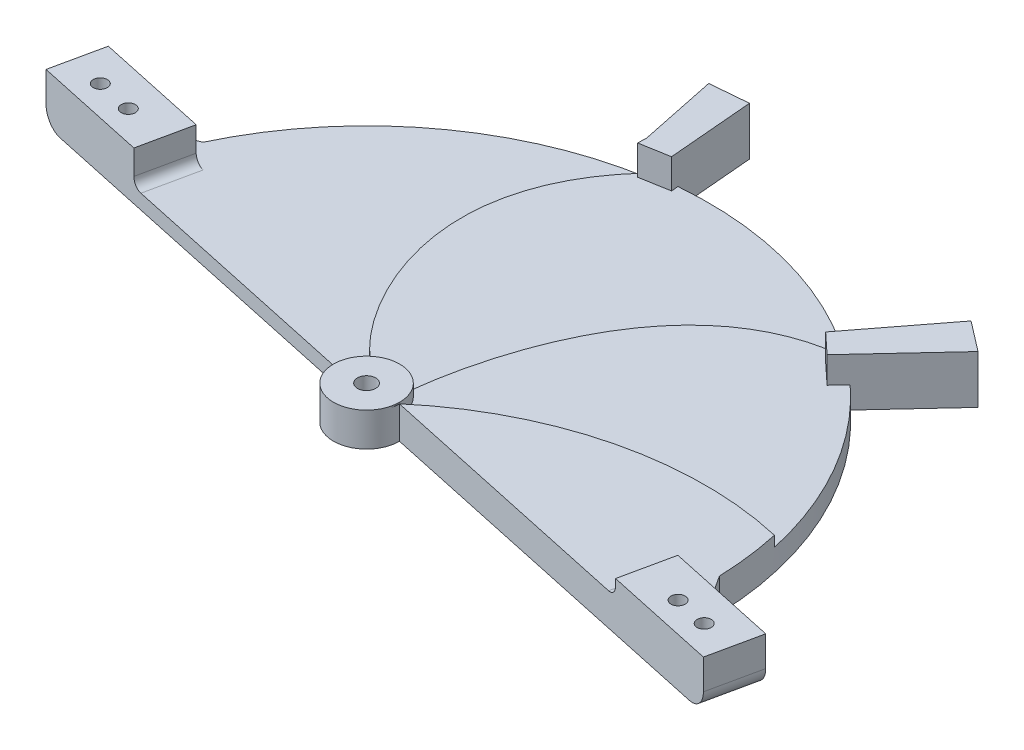
from build123d import *
from build123d.topology import SkipClean

# Parameters (mm, degrees)
SKETCH1_R            = 7.25
SKETCH1_R_2          = 2
BOSS_EXTRUDE1_DEPTH  = 7.4
BOSS_EXTRUDE3_START  = -7.4
BOSS_EXTRUDE3_DEPTH  = 2.5
BOSS_EXTRUDE4_DEPTH  = 0.9
BOSS_EXTRUDE5_DEPTH  = 0.7
BOSS_EXTRUDE6_DEPTH  = 8.4
BOSS_EXTRUDE7_START  = -2.5
BOSS_EXTRUDE7_DEPTH  = 8.4
BOSS_EXTRUDE8_START  = -4.1
BOSS_EXTRUDE8_DEPTH  = 8.4
CUT_EXTRUDE1_DEPTH   = 5
BOSS_EXTRUDE9_START  = 5
SKETCH10_R           = 7.25
SKETCH10_R_2         = 2
BOSS_EXTRUDE9_DEPTH  = 5
BOSS_EXTRUDE10_REACH = 122.721
CUT_EXTRUDE2_DEPTH   = 121.788738675
CUT_EXTRUDE3_START   = -1.3
CUT_EXTRUDE3_DEPTH   = 1.3
SKETCH17_R           = 1.55
CUT_EXTRUDE4_DEPTH   = 121.936633783
SKETCH18_R           = 1.55
BOSS_EXTRUDE11_DEPTH = 1.2
SKETCH19_R           = 1.55
BOSS_EXTRUDE12_DEPTH = 2.5
CUT_EXTRUDE5_DEPTH   = 122.0259038
SKETCH21_R           = 1.55
BOSS_EXTRUDE13_DEPTH = 1
BOSS_EXTRUDE14_DEPTH = 0.7
BOSS_EXTRUDE16_DEPTH = 0.7
BOSS_EXTRUDE17_DEPTH = 1.4
FILLET1_R            = 2
FILLET2_R            = 4
CHAMFER1_SIZE        = 4
CHAMFER1_SIZE_2      = 4.928784719
BOSS_EXTRUDE18_DEPTH = 10.6


with BuildPart() as part:
    # Sketch1 → Boss-Extrude1 (new body)
    with BuildSketch(Plane(origin=(0, 0, 0), x_dir=(1, 0, 0), z_dir=(0, 1, 0))):
        with Locations(Location((0, 0, 0), (0, 0, 270))):
            Circle(SKETCH1_R)
        with Locations(Location((0, 0, 0), (0, 0, 270))):
            Circle(SKETCH1_R_2, mode=Mode.SUBTRACT)
    extrude(amount=BOSS_EXTRUDE1_DEPTH)

    # Sketch2 → Boss-Extrude3 (add)
    with BuildSketch(Plane(origin=(0, 7.4, 0), x_dir=(1, 0, 0), z_dir=(0, 1, 0)).offset(BOSS_EXTRUDE3_START)):
        with BuildLine():
            add(Edge.make_bspline(
                [(-5.126524164, -5.126524164), (-34.917072205, -19.205568344), (-61.161686636, -4.675863942), (-71.850724271, 21.505195227)],
                knots=[0, 0, 0, 0, 0.672240243, 0.672240243, 0.672240243, 0.672240243], degree=3))
            ThreePointArc((-5.126524164, -5.126524164), (-2.774454885, 6.698126611), (7.25, 0))
            Line((7.25, 0), (75, 0))
            ThreePointArc((75, 0), (38.729833462, 64.226162893), (-35, 66.332495807))
            ThreePointArc((-35, 66.332495807), (-57.936525945, 47.62729219), (-71.850724271, 21.505195227))
        make_face()
    extrude(amount=BOSS_EXTRUDE3_DEPTH)

    # Sketch3 → Boss-Extrude4 (add)
    with BuildSketch(Plane(origin=(0, 2.5, 0), x_dir=(1, 0, 0), z_dir=(0, 1, 0))):
        with BuildLine():
            add(Edge.make_bspline(
                [(-3.625, 6.278684177), (-10.597848388, 6.793882103), (-40.677167551, 43.511602441), (-12.374173258, 73.972155817)],
                knots=[0, 0, 0, 0, 0.867348457, 0.867348457, 0.867348457, 0.867348457], degree=3))
            ThreePointArc((-3.625, 6.278684177), (3.625, 6.278684177), (7.25, 0))
            Line((7.25, 0), (75, 0))
            ThreePointArc((75, 0), (48.460999812, 57.2409949), (-12.374173258, 73.972155817))
        make_face()
    extrude(amount=BOSS_EXTRUDE4_DEPTH)



with BuildPart() as body_2:
    # Sketch4 → Boss-Extrude5 (new body)
    with BuildSketch(Plane(origin=(0, 3.4, 0), x_dir=(1, 0, 0), z_dir=(0, 1, 0))):
        with BuildLine():
            Line((7.25, 0), (75, 0))
            ThreePointArc((75, 0), (67.082039325, 33.541019662), (45, 60))
            add(Edge.make_bspline(
                [(3.625, 6.278684177), (4.262653192, 12.246368212), (10.323317408, 56.764848912), (45, 60)],
                knots=[0, 0, 0, 0, 1, 1, 1, 1], degree=3))
            ThreePointArc((3.625, 6.278684177), (6.278684177, 3.625), (7.25, 0))
        make_face()
    extrude(amount=BOSS_EXTRUDE5_DEPTH)


with BuildPart() as part_1:
    with SkipClean():  # the faces are left unmerged after this step: merging them gives an invalid solid
        add(part.part)

        add(body_2.part)  # Boss-Extrude6 merges body 2
        # Sketch6 → Boss-Extrude6 (add)
        with BuildSketch(Plane(origin=(0, 0, 0), x_dir=(-1, 0, 0), z_dir=(0, -1, 0))):
            with BuildLine():
                ThreePointArc((-75, 0), (-74.579396143, -7.931813846), (-73.32230211, -15.774663651))
                Line((-73.32230211, -15.774663651), (-7.087822537, -1.524884153))
                ThreePointArc((-7.087822537, -1.524884153), (-7.209341627, -0.766742005), (-7.25, 0))
                Line((-7.25, 0), (-75, 0))
            make_face()
        extrude(amount=-BOSS_EXTRUDE6_DEPTH)

    # Sketch7 → Boss-Extrude7 (add)
    with BuildSketch(Plane(origin=(0, 2.5, 0), x_dir=(1, 0, 0), z_dir=(0, 1, 0)).offset(BOSS_EXTRUDE7_START)):
        with BuildLine():
            Line((-63.545995162, 13.671375165), (-81.876570689, 17.615041077))
            Line((-81.876570689, 17.615041077), (-79.142687321, 30.32241961))
            Line((-79.142687321, 30.32241961), (-59.52859355, 26.102615769))
            ThreePointArc((-59.52859355, 26.102615769), (-61.850404464, 19.9881832), (-63.545995162, 13.671375165))
        make_face()
    extrude(amount=BOSS_EXTRUDE7_DEPTH)

    # Sketch8 → Boss-Extrude8 (add)
    with SkipClean():  # the faces are left unmerged after this step: merging them gives an invalid solid
        with BuildSketch(Plane(origin=(0, 4.1, 0), x_dir=(1, 0, 0), z_dir=(0, 1, 0)).offset(BOSS_EXTRUDE8_START)):
            Polygon((-79.142687321, 30.32241961), (-81.876570689, 17.615041077), (-91.765372585, 19.742531886), (-89.031489217, 32.449910419), align=None)
            with BuildLine():
                Line((73.32230211, -15.774663651), (91.765372585, -19.742531886))
                Line((91.765372585, -19.742531886), (94.499255953, -7.035153354))
                Line((94.499255953, -7.035153354), (74.946642057, -2.82857638))
                ThreePointArc((74.946642057, -2.82857638), (74.416532068, -9.33700996), (73.32230211, -15.774663651))
            make_face()
        extrude(amount=BOSS_EXTRUDE8_DEPTH)

    # Sketch9 → Cut-Extrude1 (cut)
    with BuildSketch(Plane.XZ):
        Polygon((-91.765372585, -19.742531886), (91.765372585, 19.742531886), (87.979453309, 37.339884393), (-95.551291862, -2.14517938), align=None)
    extrude(amount=-CUT_EXTRUDE1_DEPTH, mode=Mode.SUBTRACT)

    # Sketch10 → Boss-Extrude9 (add)
    with BuildSketch(Plane.XZ.offset(-5).offset(BOSS_EXTRUDE9_START)):
        Circle(SKETCH10_R)
        with Locations(Location((0, 0, 0), (0, 0, 90))):
            Circle(SKETCH10_R_2, mode=Mode.SUBTRACT)
    extrude(amount=-BOSS_EXTRUDE9_DEPTH)

    # Boss-Extrude10: up to this face of the body (flat: up to its plane)
    boss_extrude10_end = Plane(part_1.part.faces().sort_by_distance((60.073544854, 8.4, 7.102164941))[0])
    # Sketch12 → Boss-Extrude10 (add, up to the picked face)
    with BuildSketch(Plane(origin=(0, 4.1, 0), x_dir=(1, 0, 0), z_dir=(0, 1, 0)), mode=Mode.PRIVATE) as boss_extrude10_sk1:
        with BuildLine():
            Line((7.25, 0), (75, 0))
            ThreePointArc((75, 0), (74.56036467, 8.108761945), (73.246612793, 16.122459937))
            ThreePointArc((73.246612793, 16.122459937), (38.330105093, 15.91330646), (7.25, 0))
        make_face()
    boss_extrude10_tool1 = split(extrude(boss_extrude10_sk1.sketch, amount=BOSS_EXTRUDE10_REACH, mode=Mode.PRIVATE), bisect_by=boss_extrude10_end, keep=Keep.BOTH, mode=Mode.PRIVATE)
    add(boss_extrude10_tool1.solids().sort_by(Axis((46.982662, 4.1, -7.736412), (0, 1, 0)))[0])

    # Sketch13 → Cut-Extrude2 (cut, through all)
    with SkipClean():  # the faces are left unmerged after this step: merging them gives an invalid solid
        with BuildSketch(Plane(origin=(0, 2.5, 0), x_dir=(1, 0, 0), z_dir=(0, 1, 0))):
            Polygon((-59.52859355, 26.102615769), (-61.850404464, 19.9881832), (-63.545995162, 13.671375165), (-67.237617804, 14.465596075), (-64.503734436, 27.172974607), align=None)
        extrude(amount=CUT_EXTRUDE2_DEPTH, mode=Mode.SUBTRACT)

    # Sketch16 → Cut-Extrude3 (cut)
    with SkipClean():  # the faces are left unmerged after this step: merging them gives an invalid solid
        with BuildSketch(Plane(origin=(0, 8.4, 0), x_dir=(1, 0, 0), z_dir=(0, 1, 0)).offset(CUT_EXTRUDE3_START)):
            with BuildLine():
                Line((7.087822537, -1.524884153), (7.25, 0))
                ThreePointArc((7.25, 0), (38.330105093, 15.91330646), (73.246612793, 16.122459937))
                ThreePointArc((73.246612793, 16.122459937), (74.809258318, 6.710869331), (74.946642057, -2.82857638))
                Line((74.946642057, -2.82857638), (94.499255953, -7.035153354))
                Line((94.499255953, -7.035153354), (91.765372585, -19.742531886))
                Line((91.765372585, -19.742531886), (7.087822537, -1.524884153))
            make_face()
        extrude(amount=CUT_EXTRUDE3_DEPTH, mode=Mode.SUBTRACT)

    # Sketch17 → Cut-Extrude4 (cut, through all)
    with SkipClean():  # the faces are left unmerged after this step: merging them gives an invalid solid
        with BuildSketch(Plane.XZ):
            with Locations(Location((-82.816641613, -24.466016677, 0), (0, 0, 270))):
                Circle(SKETCH17_R)
            with Locations(Location((-74.995596054, -22.783385887, 0), (0, 0, 270))):
                Circle(SKETCH17_R)
            with Locations(Location((78.500615114, 10.240005813, 0), (0, 0, 270))):
                Circle(SKETCH17_R)
            with Locations(Location((85.785548012, 11.807296568, 0), (0, 0, 270))):
                Circle(SKETCH17_R)
        extrude(amount=-CUT_EXTRUDE4_DEPTH, mode=Mode.SUBTRACT)

    # Sketch18 → Boss-Extrude11 (add)
    with SkipClean():  # the faces are left unmerged after this step: merging them gives an invalid solid
        with BuildSketch(Plane(origin=(0, 8.4, 0), x_dir=(1, 0, 0), z_dir=(0, 1, 0))):
            Polygon((-89.031489217, 32.449910419), (-64.503734436, 27.172974607), (-67.237617804, 14.465596075), (-91.765372585, 19.742531886), align=None)
            with Locations(Location((-82.816641613, 24.466016677, 0), (0, 0, 90))):
                Circle(SKETCH18_R, mode=Mode.SUBTRACT)
            with Locations(Location((-74.995596054, 22.783385887, 0), (0, 0, 90))):
                Circle(SKETCH18_R, mode=Mode.SUBTRACT)
        extrude(amount=BOSS_EXTRUDE11_DEPTH)

    # Sketch19 → Boss-Extrude12 (add)
    with SkipClean():  # the faces are left unmerged after this step: merging them gives an invalid solid
        with BuildSketch(Plane(origin=(0, 7.1, 0), x_dir=(1, 0, 0), z_dir=(0, 1, 0))):
            Polygon((91.765372585, -19.742531886), (94.499255953, -7.035153354), (69.970501821, -1.758002541), (67.236618453, -14.465381073), align=None)
            with Locations(Location((78.500615114, -10.240005813, 0), (0, 0, 90))):
                Circle(SKETCH19_R, mode=Mode.SUBTRACT)
            with Locations(Location((85.785548012, -11.807296568, 0), (0, 0, 90))):
                Circle(SKETCH19_R, mode=Mode.SUBTRACT)
        extrude(amount=BOSS_EXTRUDE12_DEPTH)

    # Sketch20 → Cut-Extrude5 (cut, through all)
    with SkipClean():  # the faces are left unmerged after this step: merging them gives an invalid solid
        with BuildSketch(Plane.XZ):
            with BuildLine():
                Line((7.249919711, 0.034120129), (92.080865858, 18.276085844))
                Line((92.080865858, 18.276085844), (91.765372585, 19.742531886))
                Line((91.765372585, 19.742531886), (7.087822537, 1.524884153))
                ThreePointArc((7.087822537, 1.524884153), (7.207517432, 0.78370432), (7.249919711, 0.034120129))
            make_face()
            with BuildLine():
                Line((-7.087822537, -1.524884153), (-91.765372585, -19.742531886))
                Line((-91.765372585, -19.742531886), (-91.449879312, -21.208977929))
                Line((-91.449879312, -21.208977929), (-6.618968806, -2.95833601))
                ThreePointArc((-6.618968806, -2.95833601), (-6.89077124, -2.25383489), (-7.087822537, -1.524884153))
            make_face()
        extrude(amount=-CUT_EXTRUDE5_DEPTH, mode=Mode.SUBTRACT)

    # Sketch21 → Boss-Extrude13 (add)
    # profile 1 of 2: a face of its own
    with SkipClean():  # the faces are left unmerged after this step: merging them gives an invalid solid
        with BuildSketch(Plane(origin=(0, 9.6, 0), x_dir=(1, 0, 0), z_dir=(0, 1, 0))):
            Polygon((69.970501821, -1.758002541), (67.551595408, -13.001334932), (92.080865858, -18.276085844), (94.499255953, -7.035153354), align=None)
            with Locations(Location((85.785548012, -11.807296568, 0), (0, 0, 90))):
                Circle(SKETCH21_R, mode=Mode.SUBTRACT)
            with Locations(Location((78.500615114, -10.240005813, 0), (0, 0, 90))):
                Circle(SKETCH21_R, mode=Mode.SUBTRACT)
        # profile 2 of 2: a face of its own
        with BuildSketch(Plane(origin=(0, 9.6, 0), x_dir=(1, 0, 0), z_dir=(0, 1, 0))):
            Polygon((-89.031489217, 32.449910419), (-91.449879312, 21.208977929), (-66.922124531, 15.932042117), (-64.503734436, 27.172974607), align=None)
            with Locations(Location((-74.995596054, 22.783385887, 0), (0, 0, 90))):
                Circle(SKETCH21_R, mode=Mode.SUBTRACT)
            with Locations(Location((-82.816641613, 24.466016677, 0), (0, 0, 90))):
                Circle(SKETCH21_R, mode=Mode.SUBTRACT)
        extrude(amount=BOSS_EXTRUDE13_DEPTH)

    # Sketch22 → Boss-Extrude14 (add)
    with SkipClean():  # the faces are left unmerged after this step: merging them gives an invalid solid
        with BuildSketch(Plane(origin=(0, 2.5, 0), x_dir=(1, 0, 0), z_dir=(0, 1, 0))):
            with BuildLine():
                Line((-66.922124531, 15.932042117), (-6.618968806, 2.95833601))
                ThreePointArc((-6.618968806, 2.95833601), (-5.384320033, 4.855058989), (-3.625, 6.278684177))
                add(Edge.make_bspline(
                    [(-3.625, 6.278684177), (-10.597848388, 6.793882103), (-40.677167551, 43.511602441), (-12.374173258, 73.972155817)],
                    knots=[0, 0, 0, 0, 0.867348457, 0.867348457, 0.867348457, 0.867348457], degree=3))
                ThreePointArc((-12.374173258, 73.972155817), (-46.880291054, 58.542619609), (-69.478875321, 28.243333445))
                Line((-69.478875321, 28.243333445), (-64.503734436, 27.172974607))
                Line((-64.503734436, 27.172974607), (-66.922124531, 15.932042117))
            make_face()
        extrude(amount=BOSS_EXTRUDE14_DEPTH)

    # Sketch23 → Boss-Extrude16 (add)
    with SkipClean():  # the faces are left unmerged after this step: merging them gives an invalid solid
        with BuildSketch(Plane(origin=(0, 3.4, 0), x_dir=(1, 0, 0), z_dir=(0, 1, 0))):
            with BuildLine():
                ThreePointArc((45, 60), (17.745884796, 72.870320246), (-12.374173258, 73.972155817))
                add(Edge.make_bspline(
                    [(-12.374173258, 73.972155817), (-40.677167551, 43.511602441), (-10.597848388, 6.793882103), (-3.625, 6.278684177)],
                    knots=[0, 0, 0, 0, 0.867348457, 0.867348457, 0.867348457, 0.867348457], degree=3))
                ThreePointArc((-3.625, 6.278684177), (0, 7.25), (3.625, 6.278684177))
                add(Edge.make_bspline(
                    [(3.625, 6.278684177), (4.262653192, 12.246368212), (10.323317408, 56.764848912), (45, 60)],
                    knots=[0, 0, 0, 0, 1, 1, 1, 1], degree=3))
            make_face()
        extrude(amount=BOSS_EXTRUDE16_DEPTH)

    # Sketch23<4> → Boss-Extrude17 (add)
    with SkipClean():  # the faces are left unmerged after this step: merging them gives an invalid solid
        with BuildSketch(Plane(origin=(0, 3.4, 0), x_dir=(1, 0, 0), z_dir=(0, 1, 0))):
            with BuildLine():
                ThreePointArc((73.246612793, 16.122459937), (38.330105093, 15.91330646), (7.25, 0))
                ThreePointArc((7.25, 0), (6.278684177, 3.625), (3.625, 6.278684177))
                add(Edge.make_bspline(
                    [(3.625, 6.278684177), (4.262653192, 12.246368212), (10.323317408, 56.764848912), (45, 60)],
                    knots=[0, 0, 0, 0, 1, 1, 1, 1], degree=3))
                ThreePointArc((45, 60), (63.062468947, 40.597105935), (73.246612793, 16.122459937))
            make_face()
        extrude(amount=BOSS_EXTRUDE17_DEPTH)

    # Fillet1
    fillet1_edges = [part_1.edges().sort_by_distance(p)[0] for p in [
        (68.761048614, 7.1, 7.379668736),
        (-65.712929483, 3.2, -21.552508362),
    ]]
    fillet(fillet1_edges, radius=FILLET1_R)

    # Fillet2
    fillet2_edges = [part_1.edges().sort_by_distance(p)[0] for p in [
        (-90.240684265, 0, -26.829444174),
        (93.290060906, 0, 12.655619599),
    ]]
    fillet(fillet2_edges, radius=FILLET2_R)

    # Chamfer1
    # the kernel refuses this chamfer: 4.928784719, 4 mm, written as the material it adds along each edge
    with BuildSketch(Plane(origin=(74.946642057, 0, 2.82857638), x_dir=(0.003130013982796916, 0, -0.9999951014942361), z_dir=(0, 1, 0))) as chamfer1_piece_1:
        with BuildLine():
            Line((5.187956974, 0), (-CHAMFER1_SIZE * 0.207267820644, -CHAMFER1_SIZE * 0.978284238105))
            Line((-CHAMFER1_SIZE * 0.207267820644, -CHAMFER1_SIZE * 0.978284238105), (0, 0))
            ThreePointArc((0, 0), (2.676724413, -0.04482594), (5.187956974, 0))
        make_face()
    extrude(amount=7.1)
    with BuildSketch(Plane(origin=(-69.478875321, 2.5, -28.243333445), x_dir=(-0.977630694797596, 0, -0.21032884868598029), z_dir=(0, -1, 0))) as chamfer1_piece_2:
        with BuildLine():
            Line((CHAMFER1_SIZE_2, 0), (-0.823940493, 4.031059203))
            ThreePointArc((-0.823940493, 4.031059203), (-0.398710918, 2.091402767), (0, 0))
            Line((0, 0), (CHAMFER1_SIZE_2, 0))
        make_face()
    extrude(amount=2.5)
    with BuildSketch(Plane(origin=(-69.478875321, 2.5, -28.243333445), x_dir=(-0.9776306947975952, 0, -0.21032884868598303), z_dir=(0, 1, 0))) as chamfer1_piece_3:
        with BuildLine():
            Line((CHAMFER1_SIZE_2, 0), (-0.823940493, -4.031059203))
            ThreePointArc((-0.823940493, -4.031059203), (-0.398710918, -2.091402767), (0, 0))
            Line((0, 0), (CHAMFER1_SIZE_2, 0))
        make_face()
    extrude(amount=0.7)

    # Sketch25 → Boss-Extrude18 (add)
    with SkipClean():  # the faces are left unmerged after this step: merging them gives an invalid solid
        with BuildSketch(Plane.XZ):
            Polygon((-12.606911977, -73.932846357), (-16.182593512, -91.155483124), (-7.955963317, -91.860442679), (-6.354897298, -73.176565057), (-12.684878546, -72.072051611), align=None)
            Polygon((48.260184635, -52.648168475), (64.190977024, -69.783014191), (57.619762564, -74.829359836), (43.782660257, -56.811060424), align=None)
        extrude(amount=-BOSS_EXTRUDE18_DEPTH)


solid = part_1.part
